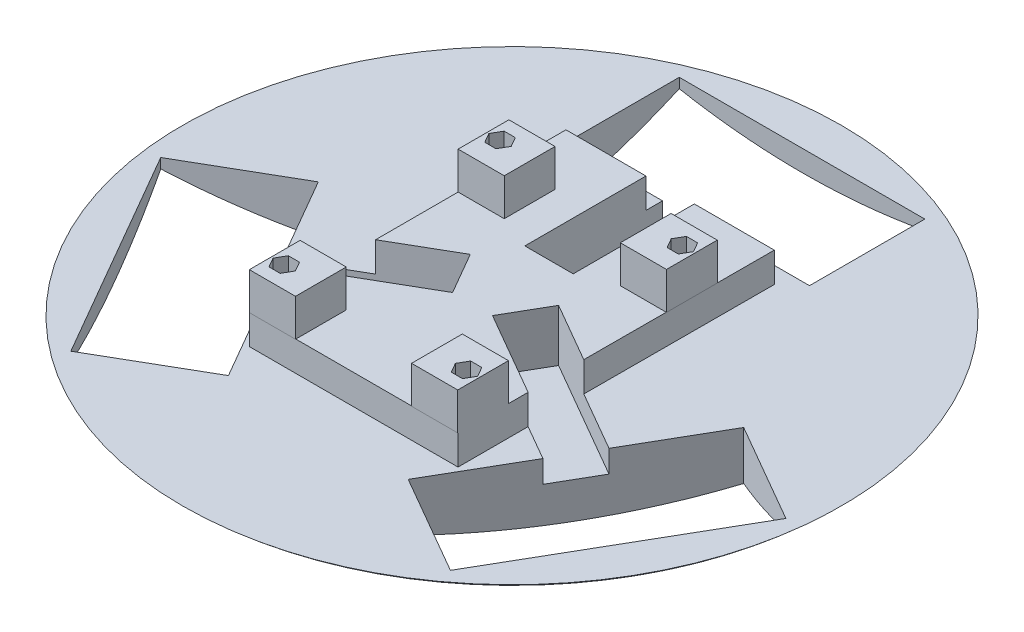
from build123d import *

# Parameters (mm, degrees)
SKETCH2_W           = 66
SKETCH2_H           = 31
CUT_EXTRUDE1_DEPTH  = 40
SKETCH4_W           = 13
SKETCH4_H           = 37
CUT_EXTRUDE2_DEPTH  = 6
BOSS_EXTRUDE1_DEPTH = 8
SKETCH6_W           = 12.402318472
SKETCH6_H           = 13.641488334
SKETCH6_H_2         = 13.641488333
BOSS_EXTRUDE2_DEPTH = 10


with BuildPart() as part:
    # Sketch3 → Revolve1 (revolve)
    with BuildSketch(Plane(origin=(0, 0, 0), x_dir=(0, 0, -1), z_dir=(1, 0, 0))):
        with BuildLine():
            Line((0, 20), (0, 0))
            ThreePointArc((0, 0), (43.440585665, 3.508757487), (84.753971762, 17.38679738))
            ThreePointArc((84.753971762, 17.38679738), (86.762776598, 18.545504508), (88.56897203, 20))
            Line((88.56897203, 20), (0, 20))
        make_face()
    revolve(axis=Axis((0, 20, 0), (0, -1, 0)))

    # Sketch2 → Cut-Extrude1 (cut)
    with BuildSketch(Plane(origin=(0, 0, 0), x_dir=(1, 0, 0), z_dir=(0, 1, 0))):
        with Locations((0, 62.449465814)):
            Rectangle(SKETCH2_W, SKETCH2_H)
        Polygon((84.006217606, -10.395894582), (51.006217606, -67.553571232), (24.159430089, -52.053571232), (57.159430089, 5.104105418), align=None)
        Polygon((-51.006217606, -67.553571232), (-84.006217606, -10.395894582), (-57.159430089, 5.104105418), (-24.159430089, -52.053571232), align=None)
    extrude(amount=CUT_EXTRUDE1_DEPTH, mode=Mode.SUBTRACT)

    # Sketch4 → Cut-Extrude2 (cut)
    with BuildSketch(Plane(origin=(0, 20, 0), x_dir=(1, 0, 0), z_dir=(0, 1, 0))):
        with Locations((0, 28.449465814)):
            Rectangle(SKETCH4_W, SKETCH4_H)
        Polygon((37.409430089, -29.103898031), (43.909430089, -17.845567782), (11.866490149, 0.654432218), (5.366490149, -10.603898031), align=None)
        Polygon((-43.909430089, -17.845567782), (-37.409430089, -29.103898031), (-5.366490149, -10.603898031), (-11.866490149, 0.654432218), align=None)
    extrude(amount=-CUT_EXTRUDE2_DEPTH, mode=Mode.SUBTRACT)

    # Sketch5 → Boss-Extrude1 (add)
    with BuildSketch(Plane(origin=(0, 20, 0), x_dir=(1, 0, 0), z_dir=(0, 1, 0))):
        Polygon((-28, 42.5), (-6.5, 42.5), (-6.5, 9.949465814), (6.5, 9.949465814), (6.5, 42.5), (28, 42.5), (27.887960119, -8.595567782), (11.866490149, 0.654432218), (5.366490149, -10.603898031), (28, -23.671361037), (28, -42.5), (-28, -42.5), (-28, -23.671361037), (-5.366490149, -10.603898031), (-11.866490149, 0.654432218), (-28, -8.660254038), align=None)
    extrude(amount=BOSS_EXTRUDE1_DEPTH)

    # Sketch6 → Boss-Extrude2 (add)
    # profile 1 of 4: a face of its own
    with BuildSketch(Plane(origin=(0, 28, 0), x_dir=(1, 0, 0), z_dir=(0, 1, 0))):
        with Locations((-21.798840764, 20.339745962)):
            Rectangle(SKETCH6_W, SKETCH6_H)
        Polygon((-21.4977786, 21.28552155), (-22.9988893, 23.88552155), (-26.0011107, 23.88552155), (-27.5022214, 21.28552155), (-26.0011107, 18.68552155), (-22.9988893, 18.68552155), align=None, mode=Mode.SUBTRACT)
    # profile 2 of 4: a face of its own
    with BuildSketch(Plane(origin=(0, 28, 0), x_dir=(1, 0, 0), z_dir=(0, 1, 0))):
        with Locations((21.798840764, 20.339745962)):
            Rectangle(SKETCH6_W, SKETCH6_H)
        Polygon((21.4977786, 21.28552155), (22.9988893, 23.88552155), (26.0011107, 23.88552155), (27.5022214, 21.28552155), (26.0011107, 18.68552155), (22.9988893, 18.68552155), align=None, mode=Mode.SUBTRACT)
    # profile 3 of 4: a face of its own
    with BuildSketch(Plane(origin=(0, 28, 0), x_dir=(1, 0, 0), z_dir=(0, 1, 0))):
        with Locations((21.798840764, -35.768702862)):
            Rectangle(SKETCH6_W, SKETCH6_H_2)
        Polygon((26.0011107, -39.31447845), (27.5022214, -36.71447845), (26.0011107, -34.11447845), (22.9988893, -34.11447845), (21.4977786, -36.71447845), (22.9988893, -39.31447845), align=None, mode=Mode.SUBTRACT)
    # profile 4 of 4: a face of its own
    with BuildSketch(Plane(origin=(0, 28, 0), x_dir=(1, 0, 0), z_dir=(0, 1, 0))):
        with Locations((-21.798840764, -35.768702862)):
            Rectangle(SKETCH6_W, SKETCH6_H_2)
        Polygon((-21.4977786, -36.71447845), (-22.9988893, -39.31447845), (-26.0011107, -39.31447845), (-27.5022214, -36.71447845), (-26.0011107, -34.11447845), (-22.9988893, -34.11447845), align=None, mode=Mode.SUBTRACT)
    extrude(amount=BOSS_EXTRUDE2_DEPTH)


solid = part.part
